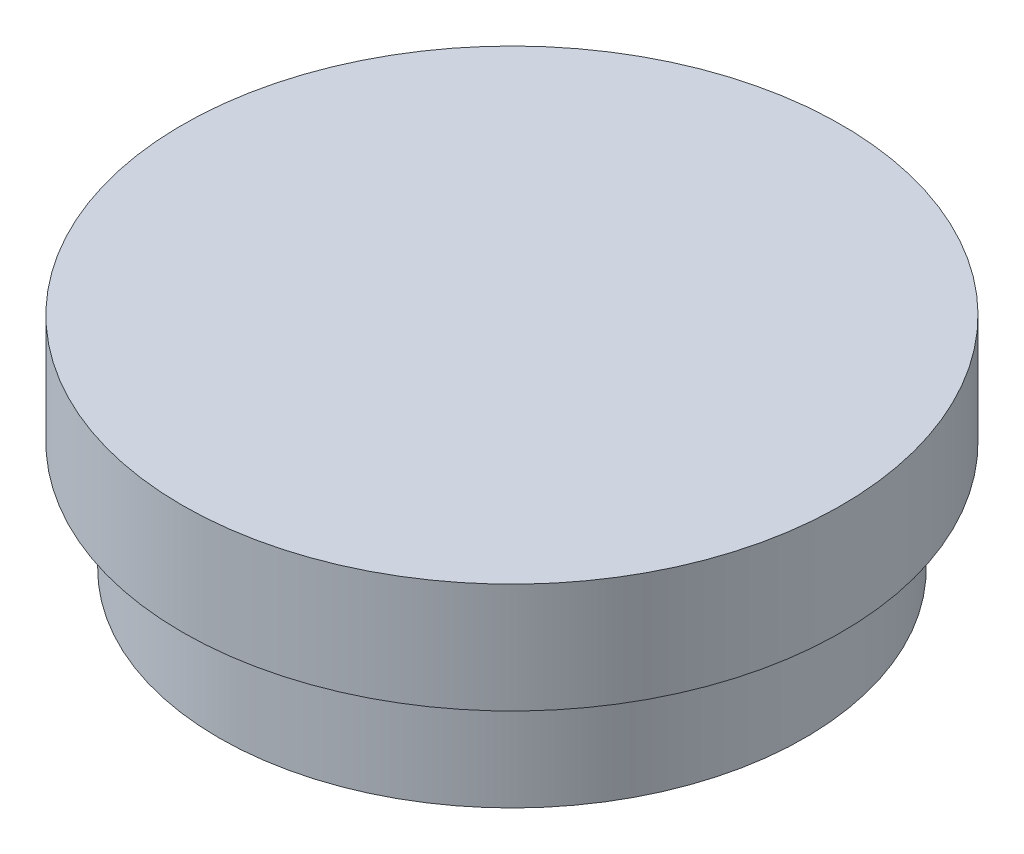
from build123d import *

# Parameters (mm, degrees)
SKETCH1_R       = 80
CASE_MATE_DEPTH = 30
SKETCH2_R       = 90
END_CAP_DEPTH   = 30


with BuildPart() as part:
    # Sketch1 → Case Mate (new body)
    with BuildSketch(Plane(origin=(0, 0, 0), x_dir=(1, 0, 0), z_dir=(0, 1, 0))):
        Circle(SKETCH1_R)
    extrude(amount=CASE_MATE_DEPTH)

    # Sketch2 → End Cap (add)
    with BuildSketch(Plane(origin=(0, 30, 0), x_dir=(1, 0, 0), z_dir=(0, 1, 0))):
        Circle(SKETCH2_R)
    extrude(amount=END_CAP_DEPTH)


solid = part.part
